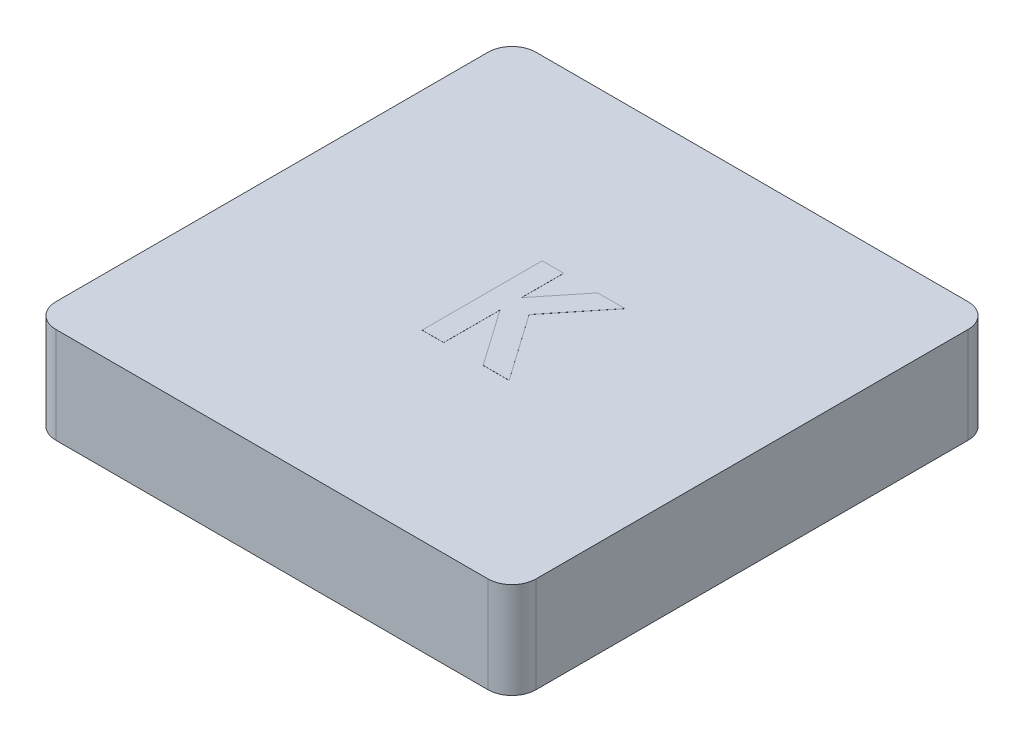
from build123d import *

# Parameters (mm, degrees)
SKETCH1_W           = 12.7
SKETCH1_H           = 12.7
BOSS_EXTRUDE1_DEPTH = 2.54
FILLET1_R           = 0.635
SHELL1_START        = 0.635
SHELL1_OUTLINE_W    = 1.905
SHELL1_OUTLINE_H    = 11.43
SHELL1_DEPTH        = 11.43
SKETCH2_R           = 2.54
BOSS_EXTRUDE2_DEPTH = 1.905
BOSS_EXTRUDE3_DEPTH = 0.00254


# Read off the part's stored shape, not the designer's step: Shell1
with BuildPart() as part:
    # Sketch1 → Boss-Extrude1 (new body)
    with BuildSketch(Plane(origin=(0, 0, 0), x_dir=(1, 0, 0), z_dir=(0, 1, 0))):
        with Locations((6.35, 6.35)):
            Rectangle(SKETCH1_W, SKETCH1_H)
    extrude(amount=BOSS_EXTRUDE1_DEPTH)

    # Fillet1
    fillet1_edges = [part.edges().sort_by_distance(p)[0] for p in [
        (0, 1.27, -12.7),
        (12.7, 1.27, -12.7),
        (12.7, 1.27, 0),
        (0, 1.27, 0),
    ]]
    fillet(fillet1_edges, radius=FILLET1_R)

    # Shell1 outline → Shell1 (cut)
    with BuildSketch(Plane.YZ.offset(SHELL1_START)):
        with Locations((0.9525, -6.35)):
            Rectangle(SHELL1_OUTLINE_W, SHELL1_OUTLINE_H)
    extrude(amount=SHELL1_DEPTH, mode=Mode.SUBTRACT)

    # Sketch2 → Boss-Extrude2 (add)
    with BuildSketch(Plane(origin=(0, 1.905, 0), x_dir=(-1, 0, 0), z_dir=(0, -1, 0))):
        with Locations(Location((-6.35, 6.35, 0), (0, 0, 270))):
            Circle(SKETCH2_R)
    extrude(amount=BOSS_EXTRUDE2_DEPTH)

    # Sketch3 → Boss-Extrude3 (add)
    with BuildSketch(Plane(origin=(0, 2.54, 0), x_dir=(1, 0, 0), z_dir=(0, 1, 0))):
        Polygon((5.497146154, 8.001), (6.067017949, 8.001), (6.067017949, 6.883517027), (6.96761891, 8.001), (7.686954848, 8.001), (6.555479487, 6.596673077), (7.796985897, 4.826), (7.110722877, 4.826), (6.067017949, 6.314917268), (6.067017949, 4.826), (5.497146154, 4.826), align=None)
    extrude(amount=BOSS_EXTRUDE3_DEPTH)


solid = part.part
